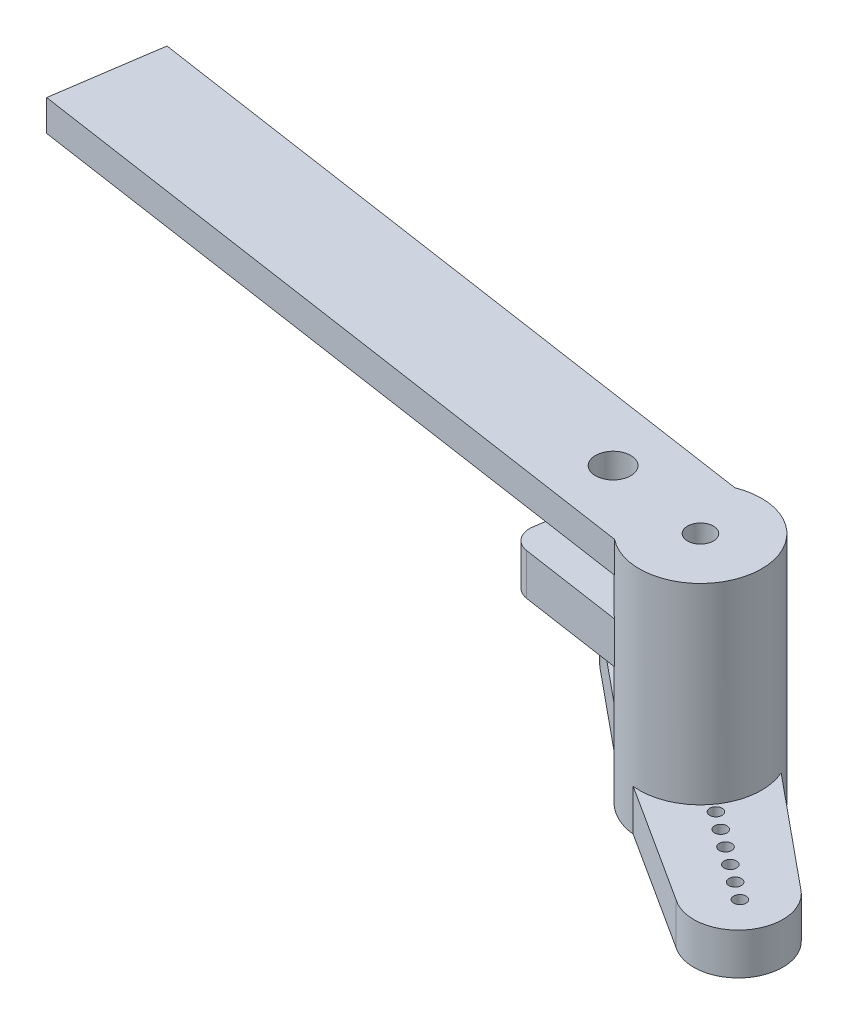
from build123d import *

# Parameters (mm, degrees)
EXTRUDE_START       = -2
EXTRUDE_1_DEPTH     = 2
SKETCH_2_R          = 0.6
SKETCH_2_R_2        = 1.25
EXTRUDE_2_DEPTH     = 2
SKETCH_3_R          = 5.9
SKETCH_3_R_2        = 1.25
EXTRUDE_3_DEPTH     = 18.5
EXTRUDE_4_DEPTH     = 3
SKETCH_5_R          = 1.7
CUT_EXTRUDE_1_DEPTH = 3
SKETCH_6_R          = 1.7
EXTRUDE_5_DEPTH     = 4


# Read off the part's stored shape, not the designer's step: 填料-伸長1
with BuildPart() as part:
    # 填料-伸長1 outline → 填料-伸長1 (new body)
    with BuildSketch(Plane(origin=(0, 18.156954032, 0), x_dir=(1, 0, 0), z_dir=(0, 1, 0)).offset(EXTRUDE_START)):
        with BuildLine():
            Line((-71.976510321, -204.833021781), (-61.351692907, -213.569524655))
            ThreePointArc((-61.351692907, -213.569524655), (-59.430720516, -215.948258819), (-56.577073779, -217.046080048))
            Line((-56.577073779, -217.046080048), (-45.000342303, -224.475246616))
            ThreePointArc((-45.000342303, -224.475246616), (-39.06215434, -223.480955011), (-39.939141491, -217.524312868))
            Line((-39.939141491, -217.524312868), (-50.563958905, -208.787809993))
            ThreePointArc((-50.563958905, -208.787809993), (-52.484931295, -206.409075829), (-55.338578032, -205.311254601))
            Line((-55.338578032, -205.311254601), (-66.915309509, -197.882088033))
            ThreePointArc((-66.915309509, -197.882088033), (-72.853497472, -198.876379638), (-71.976510321, -204.833021781))
        make_face()
        with BuildLine():
            ThreePointArc((-55.939819286, -215.078625755), (-58.253468106, -214.331448143), (-59.674933886, -212.358967399))
            Line((-59.674933886, -212.358967399), (-70.741141252, -203.259521387))
            ThreePointArc((-70.741141252, -203.259521387), (-71.236686796, -200.053632048), (-68.033499603, -199.540910248))
            Line((-68.033499603, -199.540910248), (-55.975832526, -207.278708894))
            ThreePointArc((-55.975832526, -207.278708894), (-53.662183706, -208.025886506), (-52.240717926, -209.998367249))
            Line((-52.240717926, -209.998367249), (-41.17451056, -219.097813262))
            ThreePointArc((-41.17451056, -219.097813262), (-40.678965016, -222.303702601), (-43.882152209, -222.8164244))
            Line((-43.882152209, -222.8164244), (-55.939819286, -215.078625755))
        make_face(mode=Mode.SUBTRACT)
    extrude(amount=EXTRUDE_1_DEPTH)

    # 草圖2 → 填料-伸長2 (add)
    with BuildSketch(Plane(origin=(0, 18.156954032, 0), x_dir=(1, 0, 0), z_dir=(0, 1, 0))):
        with BuildLine():
            Line((-56.577073779, -217.046080048), (-45.000342303, -224.475246616))
            ThreePointArc((-45.000342303, -224.475246616), (-39.06215434, -223.480955011), (-39.939141491, -217.524312868))
            Line((-39.939141491, -217.524312868), (-50.563958905, -208.787809993))
            ThreePointArc((-50.563958905, -208.787809993), (-52.484931296, -206.409075829), (-55.338578032, -205.311254601))
            Line((-55.338578032, -205.311254601), (-66.915309509, -197.882088033))
            ThreePointArc((-66.915309509, -197.882088033), (-72.853497472, -198.876379638), (-71.976510321, -204.833021781))
            Line((-71.976510321, -204.833021781), (-61.351692907, -213.569524655))
            ThreePointArc((-61.351692907, -213.569524655), (-59.430720516, -215.948258819), (-56.577073779, -217.046080048))
        make_face()
        with Locations(Location((-69.943238255, -200.995433976, 0), (0, 0, 180))):
            Circle(SKETCH_2_R, mode=Mode.SUBTRACT)
        with Locations(Location((-68.245587045, -202.231549007, 0), (0, 0, 180))):
            Circle(SKETCH_2_R, mode=Mode.SUBTRACT)
        with Locations(Location((-66.547935835, -203.467664037, 0), (0, 0, 180))):
            Circle(SKETCH_2_R, mode=Mode.SUBTRACT)
        with Locations(Location((-64.850284625, -204.703779068, 0), (0, 0, 180))):
            Circle(SKETCH_2_R, mode=Mode.SUBTRACT)
        with Locations(Location((-63.152633415, -205.939894099, 0), (0, 0, 180))):
            Circle(SKETCH_2_R, mode=Mode.SUBTRACT)
        with Locations(Location((-61.454982205, -207.17600913, 0), (0, 0, 180))):
            Circle(SKETCH_2_R, mode=Mode.SUBTRACT)
        with Locations(Location((-55.957825906, -211.178667324, 0), (0, 0, 180))):
            Circle(SKETCH_2_R_2, mode=Mode.SUBTRACT)
        with Locations(Location((-50.460669607, -215.181325519, 0), (0, 0, 180))):
            Circle(SKETCH_2_R, mode=Mode.SUBTRACT)
        with Locations(Location((-48.763018397, -216.41744055, 0), (0, 0, 180))):
            Circle(SKETCH_2_R, mode=Mode.SUBTRACT)
        with Locations(Location((-47.065367187, -217.65355558, 0), (0, 0, 180))):
            Circle(SKETCH_2_R, mode=Mode.SUBTRACT)
        with Locations(Location((-45.367715977, -218.889670611, 0), (0, 0, 180))):
            Circle(SKETCH_2_R, mode=Mode.SUBTRACT)
        with Locations(Location((-43.670064767, -220.125785642, 0), (0, 0, 180))):
            Circle(SKETCH_2_R, mode=Mode.SUBTRACT)
        with Locations(Location((-41.972413557, -221.361900673, 0), (0, 0, 180))):
            Circle(SKETCH_2_R, mode=Mode.SUBTRACT)
    extrude(amount=EXTRUDE_2_DEPTH)

    # 草圖3 → 填料-伸長3 (add)
    with BuildSketch(Plane(origin=(0, 20.156954032, 0), x_dir=(1, 0, 0), z_dir=(0, 1, 0))):
        with Locations(Location((-55.957825906, -211.178667324, 0), (0, 0, 180))):
            Circle(SKETCH_3_R)
        with Locations(Location((-55.957825906, -211.178667324, 0), (0, 0, 180))):
            Circle(SKETCH_3_R_2, mode=Mode.SUBTRACT)
    extrude(amount=EXTRUDE_3_DEPTH)

    # 草圖4 → 填料-伸長4 (add)
    with BuildSketch(Plane(origin=(0, 38.656954032, 0), x_dir=(1, 0, 0), z_dir=(0, 1, 0))):
        Polygon((-59.623386181, -215.801833758), (-58.127150876, -205.691953447), (-122.426781037, -196.175779785), (-123.923016342, -206.285660097), align=None)
    extrude(amount=-EXTRUDE_4_DEPTH)

    # 草圖5 → 除料-伸長1 (cut)
    with BuildSketch(Plane.XZ.offset(-35.656954032)):
        with Locations((-65.8500767, 209.714640607)):
            Circle(SKETCH_5_R)
    extrude(amount=-CUT_EXTRUDE_1_DEPTH, mode=Mode.SUBTRACT)

    # 草圖6 → 填料-伸長5 (add)
    with BuildSketch(Plane(origin=(0, 28, 0), x_dir=(1, 0, 0), z_dir=(0, 1, 0))):
        with BuildLine():
            Line((-70.340889788, -205.906137252), (-71.251514406, -212.059117246))
            ThreePointArc((-71.251514406, -212.059117246), (-70.879084415, -213.543853469), (-69.565869591, -214.330372748))
            Line((-69.565869591, -214.330372748), (-59.623386181, -215.801833758))
            ThreePointArc((-59.623386181, -215.801833758), (-61.794253874, -210.314891561), (-58.127150876, -205.691953447))
            Line((-58.127150876, -205.691953447), (-68.069634286, -204.220492436))
            ThreePointArc((-68.069634286, -204.220492436), (-69.554370509, -204.592922428), (-70.340889788, -205.906137252))
        make_face()
        with Locations((-65.8500767, -209.714640607)):
            Circle(SKETCH_6_R, mode=Mode.SUBTRACT)
    extrude(amount=EXTRUDE_5_DEPTH)


solid = part.part
